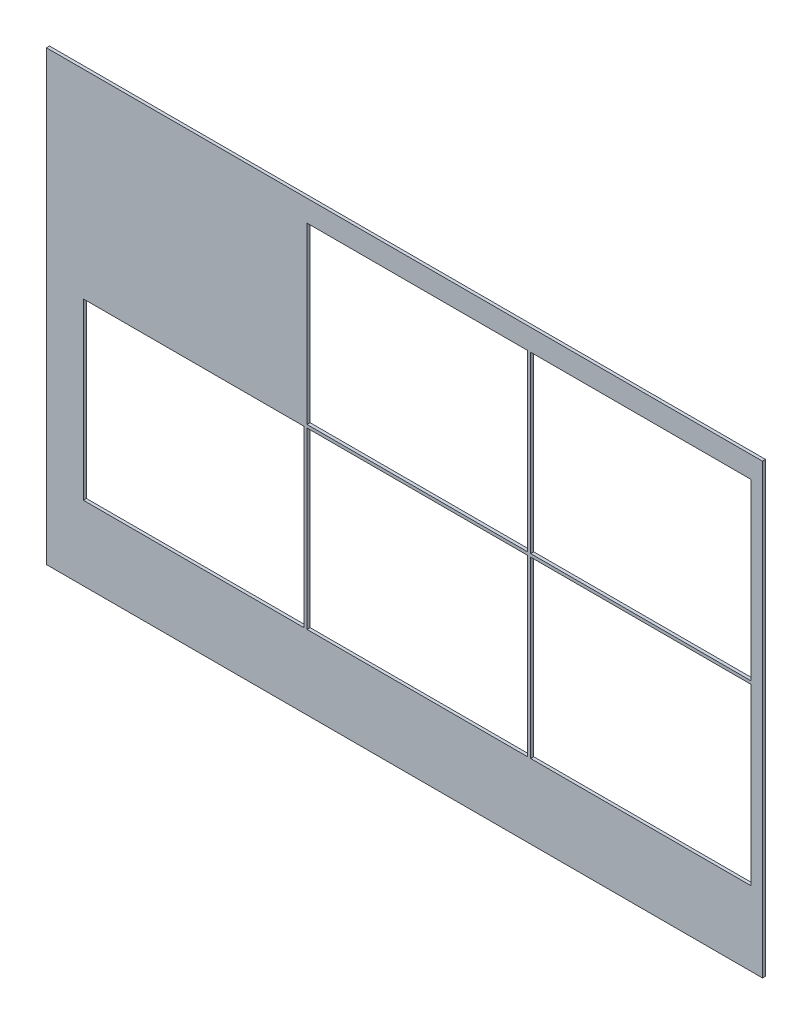
from build123d import *

# Parameters (mm, degrees)
SKETCH_1_W                  = 1396
SKETCH_1_H                  = 872.6
EXTRUDE_1_DEPTH             = 6
SKETCH_2_W                  = 430
SKETCH_2_H                  = 340
CUT_EXTRUDE_1_DEPTH         = 1045.506912375
PATTERN_LINEAR_1_COUNT      = 2
PATTERN_LINEAR_1_PITCH      = 436
PATTERN_LINEAR_1_COUNT_DIR2 = 2
PATTERN_LINEAR_1_PITCH_DIR2 = 346
SKETCH_3_W                  = 430
SKETCH_3_H                  = 340
CUT_EXTRUDE_2_DEPTH         = 1045.506912375


with BuildPart() as part:
    # Эскиз1 → Бобышка-Вытянуть1 (new body)
    with BuildSketch(Plane.XY):
        with Locations((-251, 0)):
            Rectangle(SKETCH_1_W, SKETCH_1_H)
    extrude(amount=-EXTRUDE_1_DEPTH)

    # Эскиз2 → Вырез-Вытянуть1 (cut, through all)
    with BuildSketch(Plane.XY):
        with Locations((-226, 224.3)):
            Rectangle(SKETCH_2_W, SKETCH_2_H)
    cut_extrude_1 = extrude(amount=-CUT_EXTRUDE_1_DEPTH, mode=Mode.SUBTRACT)

    # Линейный массив1: Cut-Extrude 1 2 × 2
    with Locations(*[(i * PATTERN_LINEAR_1_PITCH, -j * PATTERN_LINEAR_1_PITCH_DIR2, 0) for i in range(PATTERN_LINEAR_1_COUNT) for j in range(PATTERN_LINEAR_1_COUNT_DIR2) if (i, j) != (0, 0)]):
        add(cut_extrude_1, mode=Mode.SUBTRACT)

    # Эскиз3 → Вырез-Вытянуть2 (cut, through all)
    with BuildSketch(Plane.XY):
        with Locations((-662, -121.7)):
            Rectangle(SKETCH_3_W, SKETCH_3_H)
    extrude(amount=-CUT_EXTRUDE_2_DEPTH, mode=Mode.SUBTRACT)


solid = part.part
